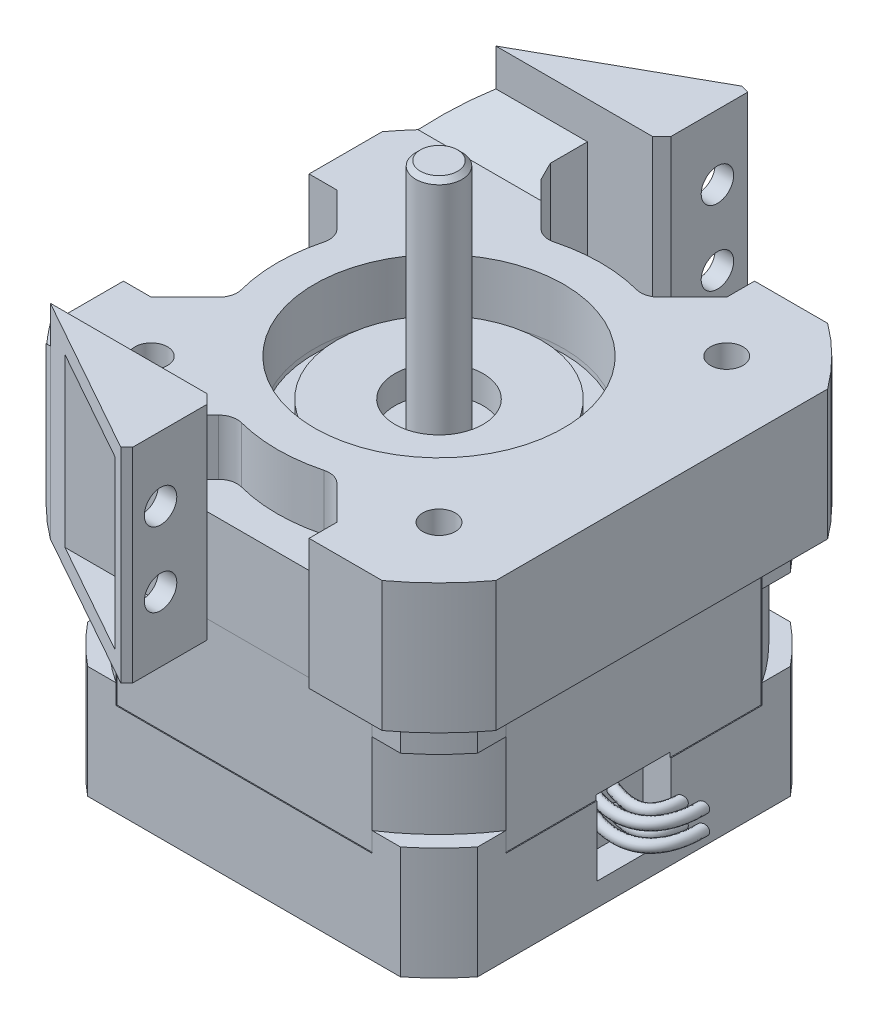
from build123d import *
from OCP.BRepFilletAPI import BRepFilletAPI_MakeChamfer

# Parameters (mm, degrees)
BOSS_EXTRUDE2_DEPTH       = 33
SKETCH3_W                 = 5
SKETCH3_H                 = 8.75
SKETCH4_R                 = 13.425
CUT_EXTRUDE1_DEPTH        = 0.5
SKETCH5_R                 = 11
BOSS_EXTRUDE3_DEPTH       = 2.5
SKETCH6_R                 = 4.75
CUT_EXTRUDE2_DEPTH        = 3
SKETCH7_R                 = 2.5
BOSS_EXTRUDE4_DEPTH       = 25.25
CHAMFER1_SIZE             = 0.5
SKETCH8_R                 = 4.5
CUT_EXTRUDE3_DEPTH        = 3
M3X0_5_TAPPED_HOLE1_D     = 2.5
M3X0_5_TAPPED_HOLE1_DEPTH = 4.5
M3X0_5_TAPPED_HOLE1_TIP   = 0.751075774
SKETCH12_W                = 8
SKETCH12_H                = 8
CUT_EXTRUDE4_DEPTH        = 3
SKETCH13_R                = 0.6
SKETCH15_W                = 27.587361236
SKETCH15_H                = 13
CUT_EXTRUDE5_DEPTH        = 0.1
CIRPATTERN1_COUNT         = 4
SKETCH16_R                = 1.75
SKETCH16_R_2              = 17.425
SKETCH16_R_3              = 13.425
BOSS_EXTRUDE5_DEPTH       = 6
BOSS_EXTRUDE6_DEPTH       = 14
BOSS_EXTRUDE6_2_DEPTH     = 14
BOSS_EXTRUDE6_3_DEPTH     = 14
FILLET1_R                 = 2
BOSS_EXTRUDE7_DEPTH       = 6
BOSS_EXTRUDE7_2_DEPTH     = 6
BOSS_EXTRUDE7_3_DEPTH     = 6
BOSS_EXTRUDE8_DEPTH       = 14
SKETCH20_W                = 8
SKETCH20_H                = 10
CUT_EXTRUDE7_DEPTH        = 34
CHAMFER2_SIZE             = 2
SKETCH19_R                = 1.75
CUT_EXTRUDE10_DEPTH       = 10
BOSS_EXTRUDE9_DEPTH       = 8
CUT_EXTRUDE11_DEPTH       = 8
SKETCH23_R                = 1.75
CUT_EXTRUDE13_DEPTH       = 2
CHAMFER3_SIZE             = 4
CHAMFER4_SIZE             = 1
CHAMFER4_SIZE2            = 0.734776912


with BuildPart() as part:
    # Sketch1 → Boss-Extrude2 (new body)
    with BuildSketch(Plane(origin=(0, 0, 0), x_dir=(1, 0, 0), z_dir=(0, 1, 0))):
        with BuildLine():
            Line((-21, 16.850982909), (-21, -16.850982909))
            ThreePointArc((-21, -16.850982909), (-19.038850083, -19.038850083), (-16.850982909, -21))
            Line((-16.850982909, -21), (16.850982909, -21))
            ThreePointArc((16.850982909, -21), (19.038850083, -19.038850083), (21, -16.850982909))
            Line((21, -16.850982909), (21, 16.850982909))
            ThreePointArc((21, 16.850982909), (19.038850083, 19.038850083), (16.850982909, 21))
            Line((16.850982909, 21), (-16.850982909, 21))
            ThreePointArc((-16.850982909, 21), (-19.038850083, 19.038850083), (-21, 16.850982909))
        make_face()
    extrude(amount=BOSS_EXTRUDE2_DEPTH)

    # Sketch3 → Cut-Revolve1 (revolve, cut)
    with BuildSketch(Plane.XY):
        with Locations((-27.625, 16.5)):
            Rectangle(SKETCH3_W, SKETCH3_H)
    revolve(axis=Axis((0, -2.013056064, 0), (0, 1, 0)), mode=Mode.SUBTRACT)

    # Sketch4 → Cut-Extrude1 (cut)
    with BuildSketch(Plane(origin=(0, 33, 0), x_dir=(1, 0, 0), z_dir=(0, 1, 0))):
        with Locations(Location((0, 0, 0), (0, 0, 270))):
            Circle(SKETCH4_R)
    extrude(amount=-CUT_EXTRUDE1_DEPTH, mode=Mode.SUBTRACT)

    # Sketch5 → Boss-Extrude3 (add)
    with BuildSketch(Plane(origin=(0, 32.5, 0), x_dir=(1, 0, 0), z_dir=(0, 1, 0))):
        with Locations(Location((0, 0, 0), (0, 0, 270))):
            Circle(SKETCH5_R)
    extrude(amount=BOSS_EXTRUDE3_DEPTH)

    # Sketch6 → Cut-Extrude2 (cut)
    with BuildSketch(Plane(origin=(0, 35, 0), x_dir=(1, 0, 0), z_dir=(0, 1, 0))):
        with Locations(Location((0, 0, 0), (0, 0, 270))):
            Circle(SKETCH6_R)
    extrude(amount=-CUT_EXTRUDE2_DEPTH, mode=Mode.SUBTRACT)

    # Sketch7 → Boss-Extrude4 (add)
    with BuildSketch(Plane(origin=(0, 32, 0), x_dir=(1, 0, 0), z_dir=(0, 1, 0))):
        with Locations(Location((0, 0, 0), (0, 0, 270))):
            Circle(SKETCH7_R)
    extrude(amount=BOSS_EXTRUDE4_DEPTH)

    # Chamfer1
    chamfer1_edges = [part.edges().sort_by_distance(p)[0] for p in [
        (0, 57.25, -2.5),
    ]]
    chamfer(chamfer1_edges, length=CHAMFER1_SIZE)

    # Sketch8 → Cut-Extrude3 (cut)
    with BuildSketch(Plane.XZ):
        with Locations(Location((0, 0, 0), (0, 0, 270))):
            Circle(SKETCH8_R)
    extrude(amount=-CUT_EXTRUDE3_DEPTH, mode=Mode.SUBTRACT)

    # M3x0.5 Tapped Hole1
    with Locations(Plane(origin=(0, 33, 0), x_dir=(1, 0, 0), z_dir=(0, 1, 0))):
        with Locations((-15.5, -15.5), (-15.5, 15.5), (15.5, 15.5), (15.5, -15.5)):
            Hole(M3X0_5_TAPPED_HOLE1_D / 2, depth=M3X0_5_TAPPED_HOLE1_DEPTH)
            with Locations((0, 0, -(M3X0_5_TAPPED_HOLE1_DEPTH + M3X0_5_TAPPED_HOLE1_TIP / 2))):  # 118° drill point
                Cone(0, M3X0_5_TAPPED_HOLE1_D / 2, M3X0_5_TAPPED_HOLE1_TIP, mode=Mode.SUBTRACT)

    # Sketch12 → Cut-Extrude4 (cut)
    with BuildSketch(Plane(origin=(21, 0, 0), x_dir=(0, 0, -1), z_dir=(1, 0, 0))):
        with Locations((0, 6.5)):
            Rectangle(SKETCH12_W, SKETCH12_H)
    extrude(amount=-CUT_EXTRUDE4_DEPTH, mode=Mode.SUBTRACT)

    # Sweep2: sweep along a path in Sketch14
    with BuildLine() as sweep2_path:  # in the path sketch's own coordinates; laid on its plane below (add() does not lay a ready-made edge on the line's plane)
        add(Edge.make_bspline(
            [(17.676713236, 0), (23.6460823, -2.366766531), (23.798444163, 3.357568307)],
            knots=[0, 0, 0, 1, 1, 1], degree=2))
    # Sketch13 → Sweep2 (sweep)
    with BuildSketch(Plane(origin=(18, 0, 0), x_dir=(0, 0, -1), z_dir=(1, 0, 0))):
        with Locations((-1.112460133, 7.415030797)):
            Circle(SKETCH13_R)
        with Locations((0.707044587, 7.415030797)):
            Circle(SKETCH13_R)
        with Locations((-1.112460133, 5.332176709)):
            Circle(SKETCH13_R)
        with Locations((0.707044587, 5.332176709)):
            Circle(SKETCH13_R)
    sweep(path=Plane(origin=(0, 0, 0), x_dir=(1, 0, 0), z_dir=(0, 1, 0)) * sweep2_path.line)

    # Sketch15 → Cut-Extrude5 (cut)
    with BuildSketch(Plane(origin=(0, 0, -21), x_dir=(-1, 0, 0), z_dir=(0, 0, -1))):
        with Locations((0, 16.5)):
            Rectangle(SKETCH15_W, SKETCH15_H)
    cut_extrude5 = extrude(amount=-CUT_EXTRUDE5_DEPTH, mode=Mode.SUBTRACT)

    # CirPattern1: Cut-Extrude5 ×4 about axis
    cirpattern1_axis = Axis((0, 0, 0), (0, 1, 0))
    for i in range(1, CIRPATTERN1_COUNT):
        add(cut_extrude5.rotate(cirpattern1_axis, i * 360 / CIRPATTERN1_COUNT), mode=Mode.SUBTRACT)


with BuildPart() as body_2:
    # Sketch16 → Boss-Extrude5 (new body)
    # profile 1 of 4: a face of its own
    with BuildSketch(Plane(origin=(0, 33, 0), x_dir=(1, 0, 0), z_dir=(0, 1, 0))):
        with BuildLine():
            Line((-16.850982909, -21), (-10.000982909, -21))
            Line((-10.000982909, -21), (-5.526402676, -16.525419767))
            ThreePointArc((-5.526402676, -16.525419767), (-12.321884857, -12.320786443), (-16.525912365, -5.524929456))
            Line((-16.525912365, -5.524929456), (-21, -9.999017091))
            Line((-21, -9.999017091), (-21, -16.850982909))
            ThreePointArc((-21, -16.850982909), (-19.038850083, -19.038850083), (-16.850982909, -21))
        make_face()
        with Locations(Location((-15.5, -15.5, 0), (0, 0, 270))):
            Circle(SKETCH16_R, mode=Mode.SUBTRACT)
    # profile 2 of 4: a face of its own
    with BuildSketch(Plane(origin=(0, 33, 0), x_dir=(1, 0, 0), z_dir=(0, 1, 0))):
        Circle(SKETCH16_R_2)
        with Locations(Location((0, 0, 0), (0, 0, 270))):
            Circle(SKETCH16_R_3, mode=Mode.SUBTRACT)
    # profile 3 of 4: a face of its own
    with BuildSketch(Plane(origin=(0, 33, 0), x_dir=(1, 0, 0), z_dir=(0, 1, 0))):
        with BuildLine():
            Line((-21, 10.000982909), (-16.525419767, 5.526402676))
            ThreePointArc((-16.525419767, 5.526402676), (-12.321335662, 12.321335662), (-5.526402676, 16.525419767))
            Line((-5.526402676, 16.525419767), (-10.000982909, 21))
            Line((-10.000982909, 21), (-16.850982909, 21))
            ThreePointArc((-16.850982909, 21), (-19.038850083, 19.038850083), (-21, 16.850982909))
            Line((-21, 16.850982909), (-21, 10.000982909))
        make_face()
        with Locations(Location((-15.5, 15.5, 0), (0, 0, 270))):
            Circle(SKETCH16_R, mode=Mode.SUBTRACT)
    # profile 4 of 4: a face of its own
    with BuildSketch(Plane(origin=(0, 33, 0), x_dir=(1, 0, 0), z_dir=(0, 1, 0))):
        with BuildLine():
            Line((5.524929456, -16.525912365), (9.999017091, -21))
            Line((9.999017091, -21), (16.850982909, -21))
            ThreePointArc((16.850982909, -21), (19.038850083, -19.038850083), (21, -16.850982909))
            Line((21, -16.850982909), (21, 16.850982909))
            ThreePointArc((21, 16.850982909), (19.038850083, 19.038850083), (16.850982909, 21))
            Line((16.850982909, 21), (9.999017091, 21))
            Line((9.999017091, 21), (5.524929456, 16.525912365))
            ThreePointArc((5.524929456, 16.525912365), (14.140412313, 10.182306449), (17.425, 0))
            ThreePointArc((17.425, 0), (14.140412313, -10.182306449), (5.524929456, -16.525912365))
        make_face()
        with Locations(Location((15.5, -15.5, 0), (0, 0, 270))):
            Circle(SKETCH16_R, mode=Mode.SUBTRACT)
        with Locations(Location((15.5, 15.5, 0), (0, 0, 270))):
            Circle(SKETCH16_R, mode=Mode.SUBTRACT)
    extrude(amount=BOSS_EXTRUDE5_DEPTH)

    # Fillet1
    fillet1_edges = [body_2.edges().sort_by_distance(p)[0] for p in [
        (-16.525912365, 36, 5.524929456),
        (-16.525419767, 36, -5.526402676),
        (-5.526402676, 36, -16.525419767),
        (5.524929456, 36, -16.525912365),
        (5.524929456, 36, 16.525912365),
        (-5.526402676, 36, 16.525419767),
    ]]
    fillet(fillet1_edges, radius=FILLET1_R)


with BuildPart() as body_3:
    # Sketch17 → Boss-Extrude6 (new body)
    with BuildSketch(Plane(origin=(0, 39, 0), x_dir=(1, 0, 0), z_dir=(0, 1, 0))):
        with BuildLine():
            Line((-24, 10.000982909), (-21.5, 10.000982909))
            Line((-21.5, 10.000982909), (-21.5, 17.025881034))
            ThreePointArc((-21.5, 17.025881034), (-19.392403474, 19.392403474), (-17.025881034, 21.5))
            Line((-17.025881034, 21.5), (-10.000982909, 21.5))
            Line((-10.000982909, 21.5), (-10.000982909, 24))
            Line((-10.000982909, 24), (-17.874720278, 24))
            ThreePointArc((-17.874720278, 24), (-21.160170427, 21.160170427), (-24, 17.874720278))
            Line((-24, 17.874720278), (-24, 10.000982909))
        make_face()
    extrude(amount=-BOSS_EXTRUDE6_DEPTH)


with BuildPart() as body_4:
    # Sketch17 → Boss-Extrude6 2 (new body)
    with BuildSketch(Plane(origin=(0, 39, 0), x_dir=(1, 0, 0), z_dir=(0, 1, 0))):
        with BuildLine():
            Line((-21.5, -17.025881034), (-21.5, -9.999017091))
            Line((-21.5, -9.999017091), (-24, -9.999017091))
            Line((-24, -9.999017091), (-24, -17.874720278))
            ThreePointArc((-24, -17.874720278), (-21.160170427, -21.160170427), (-17.874720278, -24))
            Line((-17.874720278, -24), (-10.000982909, -24))
            Line((-10.000982909, -24), (-10.000982909, -21.5))
            Line((-10.000982909, -21.5), (-17.025881034, -21.5))
            ThreePointArc((-17.025881034, -21.5), (-19.392403474, -19.392403474), (-21.5, -17.025881034))
        make_face()
    extrude(amount=-BOSS_EXTRUDE6_2_DEPTH)


with BuildPart() as body_5:
    # Sketch17 → Boss-Extrude6 3 (new body)
    with BuildSketch(Plane(origin=(0, 39, 0), x_dir=(1, 0, 0), z_dir=(0, 1, 0))):
        with BuildLine():
            Line((9.999017091, 24), (9.999017091, 21.5))
            Line((9.999017091, 21.5), (17.025881034, 21.5))
            ThreePointArc((17.025881034, 21.5), (19.392403474, 19.392403474), (21.5, 17.025881034))
            Line((21.5, 17.025881034), (21.5, -17.025881034))
            ThreePointArc((21.5, -17.025881034), (19.392403474, -19.392403474), (17.025881034, -21.5))
            Line((17.025881034, -21.5), (9.999017091, -21.5))
            Line((9.999017091, -21.5), (9.999017091, -24))
            Line((9.999017091, -24), (17.874720278, -24))
            ThreePointArc((17.874720278, -24), (21.160170427, -21.160170427), (24, -17.874720278))
            Line((24, -17.874720278), (24, 17.874720278))
            ThreePointArc((24, 17.874720278), (21.160170427, 21.160170427), (17.874720278, 24))
            Line((17.874720278, 24), (9.999017091, 24))
        make_face()
    extrude(amount=-BOSS_EXTRUDE6_3_DEPTH)


with BuildPart() as body_6:
    # Sketch17<4> → Boss-Extrude7 (new body)
    with BuildSketch(Plane(origin=(0, 39, 0), x_dir=(1, 0, 0), z_dir=(0, 1, 0))):
        with BuildLine():
            Line((-21, -9.999017091), (-21.5, -9.999017091))
            Line((-21.5, -9.999017091), (-21.5, -17.025881034))
            ThreePointArc((-21.5, -17.025881034), (-19.392403474, -19.392403474), (-17.025881034, -21.5))
            Line((-17.025881034, -21.5), (-10.000982909, -21.5))
            Line((-10.000982909, -21.5), (-10.000982909, -21))
            Line((-10.000982909, -21), (-16.850982909, -21))
            ThreePointArc((-16.850982909, -21), (-19.038850083, -19.038850083), (-21, -16.850982909))
            Line((-21, -16.850982909), (-21, -9.999017091))
        make_face()
    extrude(amount=-BOSS_EXTRUDE7_DEPTH)


with BuildPart() as body_7:
    # Sketch17<4> → Boss-Extrude7 2 (new body)
    with BuildSketch(Plane(origin=(0, 39, 0), x_dir=(1, 0, 0), z_dir=(0, 1, 0))):
        with BuildLine():
            Line((-21.5, 10.000982909), (-21, 10.000982909))
            Line((-21, 10.000982909), (-21, 16.850982909))
            ThreePointArc((-21, 16.850982909), (-19.038850083, 19.038850083), (-16.850982909, 21))
            Line((-16.850982909, 21), (-10.000982909, 21))
            Line((-10.000982909, 21), (-10.000982909, 21.5))
            Line((-10.000982909, 21.5), (-17.025881034, 21.5))
            ThreePointArc((-17.025881034, 21.5), (-19.392403474, 19.392403474), (-21.5, 17.025881034))
            Line((-21.5, 17.025881034), (-21.5, 10.000982909))
        make_face()
    extrude(amount=-BOSS_EXTRUDE7_2_DEPTH)


with BuildPart() as body_8:
    # Sketch17<4> → Boss-Extrude7 3 (new body)
    with BuildSketch(Plane(origin=(0, 39, 0), x_dir=(1, 0, 0), z_dir=(0, 1, 0))):
        with BuildLine():
            Line((17.025881034, 21.5), (9.999017091, 21.5))
            Line((9.999017091, 21.5), (9.999017091, 21))
            Line((9.999017091, 21), (16.850982909, 21))
            ThreePointArc((16.850982909, 21), (19.038850083, 19.038850083), (21, 16.850982909))
            Line((21, 16.850982909), (21, -16.850982909))
            ThreePointArc((21, -16.850982909), (19.038850083, -19.038850083), (16.850982909, -21))
            Line((16.850982909, -21), (9.999017091, -21))
            Line((9.999017091, -21), (9.999017091, -21.5))
            Line((9.999017091, -21.5), (17.025881034, -21.5))
            ThreePointArc((17.025881034, -21.5), (19.392403474, -19.392403474), (21.5, -17.025881034))
            Line((21.5, -17.025881034), (21.5, 17.025881034))
            ThreePointArc((21.5, 17.025881034), (19.392403474, 19.392403474), (17.025881034, 21.5))
        make_face()
    extrude(amount=-BOSS_EXTRUDE7_3_DEPTH)


with BuildPart() as body_5_1:
    add(body_5.part)

    # Combine2: union body 8, body 7, body 2, body 3, body 4, body 6
    add(body_8.part)
    add(body_7.part)
    add(body_2.part)
    add(body_3.part)
    add(body_4.part)
    add(body_6.part)

    # Sketch18 → Boss-Extrude8 (add)
    with BuildSketch(Plane(origin=(0, 39, 0), x_dir=(1, 0, 0), z_dir=(0, 1, 0))):
        Polygon((-10.000982909, 24), (-0.000982909, 24), (-0.000982909, 34), (-17.874720278, 24), align=None)
        Polygon((-17.874720278, -24), (-0.000982909, -24), (-0.000982909, -34), align=None)
    extrude(amount=-BOSS_EXTRUDE8_DEPTH)

    # Sketch20 → Cut-Extrude7 (cut)
    with BuildSketch(Plane(origin=(-2.000982909, 0, 0), x_dir=(0, 0, -1), z_dir=(1, 0, 0))):
        with Locations((30, 32)):
            Rectangle(SKETCH20_W, SKETCH20_H)
        with Locations((-30, 32)):
            Rectangle(SKETCH20_W, SKETCH20_H)
    extrude(amount=-CUT_EXTRUDE7_DEPTH, mode=Mode.SUBTRACT)

    # Chamfer2
    chamfer2_edges = [body_5_1.edges().sort_by_distance(p)[0] for p in [
        (-10.000982909, 32, -24),
        (-10.000982909, 32, 24),
    ]]
    chamfer(chamfer2_edges, length=CHAMFER2_SIZE)

    # Sketch19 → Cut-Extrude10 (cut)
    with BuildSketch(Plane(origin=(-0.000982909, 0, 0), x_dir=(0, 0, -1), z_dir=(1, 0, 0))):
        with Locations((30, 32)):
            Circle(SKETCH19_R)
        with Locations((-30, 32)):
            Circle(SKETCH19_R)
    extrude(amount=-CUT_EXTRUDE10_DEPTH, mode=Mode.SUBTRACT)

    # Sketch21 → Boss-Extrude9 (add)
    with BuildSketch(Plane(origin=(0, 39, 0), x_dir=(1, 0, 0), z_dir=(0, 1, 0))):
        Polygon((-17.874720278, -24), (-8.000982909, -24), (-0.000982909, -24), (-0.000982909, -34), align=None)
        Polygon((-8.000982909, 24), (-17.874720278, 24), (-0.000982909, 34), (-0.000982909, 24), align=None)
    extrude(amount=BOSS_EXTRUDE9_DEPTH)

    # Sketch22 → Cut-Extrude11 (cut)
    with BuildSketch(Plane.XZ.offset(-37)):
        Polygon((-14.299972804, -26), (-2.000982909, -32.881039841), (-2.000982909, -26), align=None)
        Polygon((-14.299972804, 26), (-2.000982909, 26), (-2.000982909, 32.881039841), align=None)
    extrude(amount=-CUT_EXTRUDE11_DEPTH, mode=Mode.SUBTRACT)

    # Sketch23 → Cut-Extrude13 (cut)
    with BuildSketch(Plane.ZY.offset(2.000982909)):
        with Locations((30, 40)):
            Circle(SKETCH23_R)
        with Locations((-30, 40)):
            Circle(SKETCH23_R)
    extrude(amount=-CUT_EXTRUDE13_DEPTH, mode=Mode.SUBTRACT)

    # Chamfer3
    # the kernel refuses this chamfer: 4 mm, written as the material it adds along each edge
    with BuildSketch(Plane(origin=(-28.161452229, 39, -24), x_dir=(0, -0.027495876610585623, 0.9996219169112968), z_dir=(1, 0, 0))) as chamfer3_piece_1_section:
        Polygon((CHAMFER3_SIZE * 0.999621916911, -CHAMFER3_SIZE * 0.0274958766106), (-CHAMFER3_SIZE * 0.0274958766106, -CHAMFER3_SIZE * 0.999621916911), (0, 0), align=None)
    chamfer3_piece_1 = extrude(amount=30.447201272, mode=Mode.PRIVATE)
    chamfer3_piece_1 = split(chamfer3_piece_1, bisect_by=Plane(origin=(-13.573491828, 40.190140446, -24.572508919), z_dir=(-0.7071067811865431, 0, 0.7071067811865519)), keep=Keep.TOP, mode=Mode.PRIVATE)
    chamfer3_piece_1 = chamfer3_piece_1 & Plane(origin=(0, 40.190140446, 0), x_dir=(-0.5973173025073211, 0, -0.8020050125313292), z_dir=(0, 1, 0)) * Cylinder(29.925, 77, mode=Mode.PRIVATE)
    chamfer3_piece_1 = split(chamfer3_piece_1, bisect_by=Plane(origin=(-12.632482531, 40.190140446, -19.368500378), z_dir=(-0.7071067811865476, 0, -0.7071067811865476)), keep=Keep.TOP, mode=Mode.PRIVATE)
    chamfer3_piece_1 = split(chamfer3_piece_1, bisect_by=Plane(origin=(-16.886535328, 40.190140446, -24.552869794), z_dir=(0.4882579176655908, 0, 0.8726993788452363)), keep=Keep.TOP, mode=Mode.PRIVATE)
    add(chamfer3_piece_1)
    with BuildSketch(Plane(origin=(-28.161452229, 39, -24), x_dir=(0, -0.027495876610585623, 0.9996219169112968), z_dir=(1, 0, 0))) as chamfer3_piece_2_section:
        Polygon((CHAMFER3_SIZE * 0.999621916911, -CHAMFER3_SIZE * 0.0274958766106), (-CHAMFER3_SIZE * 0.0274958766106, -CHAMFER3_SIZE * 0.999621916911), (0, 0), align=None)
    chamfer3_piece_2 = extrude(amount=30.447201272, mode=Mode.PRIVATE)
    chamfer3_piece_2 = split(chamfer3_piece_2, bisect_by=Plane(origin=(-10.000982909, 40.640462422, -23.281768018), z_dir=(-1, 0, 0)), keep=Keep.TOP, mode=Mode.PRIVATE)
    chamfer3_piece_2 = split(chamfer3_piece_2, bisect_by=Plane(origin=(-11.713613426, 40.640462422, -22.712630517), z_dir=(0.7071067811865431, 0, -0.7071067811865519)), keep=Keep.TOP, mode=Mode.PRIVATE)
    chamfer3_piece_2 = split(chamfer3_piece_2, bisect_by=Plane(origin=(-9.931845408, 40.640462422, -22.069137501), z_dir=(-0.7071067811865476, 0, -0.7071067811865476)), keep=Keep.TOP, mode=Mode.PRIVATE)
    add(chamfer3_piece_2)
    with BuildSketch(Plane(origin=(-28.161452229, 39, -24), x_dir=(0, -0.027495876610585623, 0.9996219169112968), z_dir=(1, 0, 0))) as chamfer3_piece_3_section:
        Polygon((CHAMFER3_SIZE * 0.999621916911, -CHAMFER3_SIZE * 0.0274958766106), (-CHAMFER3_SIZE * 0.0274958766106, -CHAMFER3_SIZE * 0.999621916911), (0, 0), align=None)
    chamfer3_piece_3 = extrude(amount=30.447201272, mode=Mode.PRIVATE)
    chamfer3_piece_3 = split(chamfer3_piece_3, bisect_by=Plane(origin=(-10.000982909, 39.287111889, -20.710319655), z_dir=(-1, 0, 0)), keep=Keep.TOP, mode=Mode.PRIVATE)
    chamfer3_piece_3 = split(chamfer3_piece_3, bisect_by=Plane(origin=(-10.189906984, 39.287111889, -21.188924075), z_dir=(-0.7071067811865431, 0, 0.7071067811865519)), keep=Keep.TOP, mode=Mode.PRIVATE)
    chamfer3_piece_3 = split(chamfer3_piece_3, bisect_by=Plane(origin=(-10.979587329, 39.287111889, -21.02139558), z_dir=(0.7071067811865476, 0, 0.7071067811865476)), keep=Keep.TOP, mode=Mode.PRIVATE)
    add(chamfer3_piece_3)
    with BuildSketch(Plane(origin=(-28.161452229, 39, -24), x_dir=(0, -0.027495876610585623, 0.9996219169112968), z_dir=(1, 0, 0))) as chamfer3_piece_4_section:
        Polygon((CHAMFER3_SIZE * 0.999621916911, -CHAMFER3_SIZE * 0.0274958766106), (-CHAMFER3_SIZE * 0.0274958766106, -CHAMFER3_SIZE * 0.999621916911), (0, 0), align=None)
    chamfer3_piece_4 = extrude(amount=30.447201272, mode=Mode.PRIVATE)
    chamfer3_piece_4 = split(chamfer3_piece_4, bisect_by=Plane(origin=(-10.000982909, 40.745550049, -23.470489523), z_dir=(1, 0, 0)), keep=Keep.TOP, mode=Mode.PRIVATE)
    chamfer3_piece_4 = split(chamfer3_piece_4, bisect_by=Plane(origin=(-8.898115767, 40.745550049, -23.102867142), z_dir=(-0.7071067811865476, 0, -0.7071067811865476)), keep=Keep.TOP, mode=Mode.PRIVATE)
    add(chamfer3_piece_4)
    with BuildSketch(Plane(origin=(-28.161452229, 39, -24), x_dir=(0, -0.027495876610585623, 0.9996219169112968), z_dir=(1, 0, 0))) as chamfer3_piece_5_section:
        Polygon((CHAMFER3_SIZE * 0.999621916911, -CHAMFER3_SIZE * 0.0274958766106), (-CHAMFER3_SIZE * 0.0274958766106, -CHAMFER3_SIZE * 0.999621916911), (0, 0), align=None)
    chamfer3_piece_5 = extrude(amount=30.447201272, mode=Mode.PRIVATE)
    chamfer3_piece_5 = split(chamfer3_piece_5, bisect_by=Plane(origin=(-10.000982909, 39.715355769, -21.525090249), z_dir=(-1, 0, 0)), keep=Keep.TOP, mode=Mode.PRIVATE)
    chamfer3_piece_5 = split(chamfer3_piece_5, bisect_by=Plane(origin=(-10.346849718, 39.715355769, -21.345866809), z_dir=(0.7071067811865431, 0, -0.7071067811865519)), keep=Keep.TOP, mode=Mode.PRIVATE)
    chamfer3_piece_5 = split(chamfer3_piece_5, bisect_by=Plane(origin=(-10.321759469, 39.715355769, -21.67922344), z_dir=(0.7071067811865476, 0, 0.7071067811865476)), keep=Keep.TOP, mode=Mode.PRIVATE)
    add(chamfer3_piece_5)
    with BuildSketch(Plane(origin=(-28.161452229, 39, -24), x_dir=(0, -0.027495876610585623, 0.9996219169112968), z_dir=(1, 0, 0))) as chamfer3_piece_6_section:
        Polygon((CHAMFER3_SIZE * 0.999621916911, -CHAMFER3_SIZE * 0.0274958766106), (-CHAMFER3_SIZE * 0.0274958766106, -CHAMFER3_SIZE * 0.999621916911), (0, 0), align=None)
    chamfer3_piece_6 = extrude(amount=30.447201272, mode=Mode.PRIVATE)
    chamfer3_piece_6 = split(chamfer3_piece_6, bisect_by=Plane(origin=(-10.000982909, 39.127257252, -20.409088831), z_dir=(1, 0, 0)), keep=Keep.TOP, mode=Mode.PRIVATE)
    chamfer3_piece_6 = split(chamfer3_piece_6, bisect_by=Plane(origin=(-9.557799532, 39.127257252, -20.556816623), z_dir=(-0.7071067811865431, 0, 0.7071067811865519)), keep=Keep.TOP, mode=Mode.PRIVATE)
    add(chamfer3_piece_6)
    with BuildSketch(Plane(origin=(2.285749043, 39, 24), x_dir=(0, -0.027495876610585623, -0.9996219169112968), z_dir=(-1, 0, 0))) as chamfer3_piece_7_section:
        Polygon((CHAMFER3_SIZE * 0.999621916911, -CHAMFER3_SIZE * 0.0274958766106), (-CHAMFER3_SIZE * 0.0274958766106, -CHAMFER3_SIZE * 0.999621916911), (0, 0), align=None)
    chamfer3_piece_7 = extrude(amount=30.447201272, mode=Mode.PRIVATE)
    chamfer3_piece_7 = split(chamfer3_piece_7, bisect_by=Plane(origin=(-10.000982909, 40.745550049, 23.470489523), z_dir=(1, 0, 0)), keep=Keep.TOP, mode=Mode.PRIVATE)
    chamfer3_piece_7 = split(chamfer3_piece_7, bisect_by=Plane(origin=(-8.898115767, 40.745550049, 23.102867142), z_dir=(-0.7071067811865476, 0, 0.7071067811865476)), keep=Keep.TOP, mode=Mode.PRIVATE)
    add(chamfer3_piece_7)
    with BuildSketch(Plane(origin=(2.285749043, 39, 24), x_dir=(0, -0.027495876610585623, -0.9996219169112968), z_dir=(-1, 0, 0))) as chamfer3_piece_8_section:
        Polygon((CHAMFER3_SIZE * 0.999621916911, -CHAMFER3_SIZE * 0.0274958766106), (-CHAMFER3_SIZE * 0.0274958766106, -CHAMFER3_SIZE * 0.999621916911), (0, 0), align=None)
    chamfer3_piece_8 = extrude(amount=30.447201272, mode=Mode.PRIVATE)
    chamfer3_piece_8 = split(chamfer3_piece_8, bisect_by=Plane(origin=(-10.346849718, 39.715355769, 21.345866809), z_dir=(0.7071067811865487, 0, 0.7071067811865465)), keep=Keep.TOP, mode=Mode.PRIVATE)
    chamfer3_piece_8 = split(chamfer3_piece_8, bisect_by=Plane(origin=(-10.000982909, 39.715355769, 21.525090249), z_dir=(-1, 0, 0)), keep=Keep.TOP, mode=Mode.PRIVATE)
    chamfer3_piece_8 = split(chamfer3_piece_8, bisect_by=Plane(origin=(-10.321759469, 39.715355769, 21.67922344), z_dir=(0.7071067811865476, 0, -0.7071067811865476)), keep=Keep.TOP, mode=Mode.PRIVATE)
    add(chamfer3_piece_8)
    with BuildSketch(Plane(origin=(2.285749043, 39, 24), x_dir=(0, -0.027495876610585623, -0.9996219169112968), z_dir=(-1, 0, 0))) as chamfer3_piece_9_section:
        Polygon((CHAMFER3_SIZE * 0.999621916911, -CHAMFER3_SIZE * 0.0274958766106), (-CHAMFER3_SIZE * 0.0274958766106, -CHAMFER3_SIZE * 0.999621916911), (0, 0), align=None)
    chamfer3_piece_9 = extrude(amount=30.447201272, mode=Mode.PRIVATE)
    chamfer3_piece_9 = split(chamfer3_piece_9, bisect_by=Plane(origin=(-9.557799532, 39.127257252, 20.556816623), z_dir=(-0.7071067811865487, 0, -0.7071067811865465)), keep=Keep.TOP, mode=Mode.PRIVATE)
    chamfer3_piece_9 = split(chamfer3_piece_9, bisect_by=Plane(origin=(-10.000982909, 39.127257252, 20.409088831), z_dir=(1, 0, 0)), keep=Keep.TOP, mode=Mode.PRIVATE)
    add(chamfer3_piece_9)
    with BuildSketch(Plane(origin=(2.285749043, 39, 24), x_dir=(0, -0.027495876610585623, -0.9996219169112968), z_dir=(-1, 0, 0))) as chamfer3_piece_10_section:
        Polygon((CHAMFER3_SIZE * 0.999621916911, -CHAMFER3_SIZE * 0.0274958766106), (-CHAMFER3_SIZE * 0.0274958766106, -CHAMFER3_SIZE * 0.999621916911), (0, 0), align=None)
    chamfer3_piece_10 = extrude(amount=30.447201272, mode=Mode.PRIVATE)
    chamfer3_piece_10 = split(chamfer3_piece_10, bisect_by=Plane(origin=(-11.713613426, 40.640462422, 22.712630517), z_dir=(0.7071067811865487, 0, 0.7071067811865465)), keep=Keep.TOP, mode=Mode.PRIVATE)
    chamfer3_piece_10 = split(chamfer3_piece_10, bisect_by=Plane(origin=(-10.000982909, 40.640462422, 23.281768018), z_dir=(-1, 0, 0)), keep=Keep.TOP, mode=Mode.PRIVATE)
    chamfer3_piece_10 = split(chamfer3_piece_10, bisect_by=Plane(origin=(-9.931845408, 40.640462422, 22.069137501), z_dir=(-0.7071067811865476, 0, 0.7071067811865476)), keep=Keep.TOP, mode=Mode.PRIVATE)
    add(chamfer3_piece_10)
    with BuildSketch(Plane(origin=(2.285749043, 39, 24), x_dir=(0, -0.027495876610585623, -0.9996219169112968), z_dir=(-1, 0, 0))) as chamfer3_piece_11_section:
        Polygon((CHAMFER3_SIZE * 0.999621916911, -CHAMFER3_SIZE * 0.0274958766106), (-CHAMFER3_SIZE * 0.0274958766106, -CHAMFER3_SIZE * 0.999621916911), (0, 0), align=None)
    chamfer3_piece_11 = extrude(amount=30.447201272, mode=Mode.PRIVATE)
    chamfer3_piece_11 = split(chamfer3_piece_11, bisect_by=Plane(origin=(-10.189906984, 39.287111889, 21.188924075), z_dir=(-0.7071067811865487, 0, -0.7071067811865465)), keep=Keep.TOP, mode=Mode.PRIVATE)
    chamfer3_piece_11 = split(chamfer3_piece_11, bisect_by=Plane(origin=(-10.000982909, 39.287111889, 20.710319655), z_dir=(-1, 0, 0)), keep=Keep.TOP, mode=Mode.PRIVATE)
    chamfer3_piece_11 = split(chamfer3_piece_11, bisect_by=Plane(origin=(-10.979587329, 39.287111889, 21.02139558), z_dir=(0.7071067811865476, 0, -0.7071067811865476)), keep=Keep.TOP, mode=Mode.PRIVATE)
    add(chamfer3_piece_11)
    with BuildSketch(Plane(origin=(2.285749043, 39, 24), x_dir=(0, -0.027495876610585623, -0.9996219169112968), z_dir=(-1, 0, 0))) as chamfer3_piece_12_section:
        Polygon((CHAMFER3_SIZE * 0.999621916911, -CHAMFER3_SIZE * 0.0274958766106), (-CHAMFER3_SIZE * 0.0274958766106, -CHAMFER3_SIZE * 0.999621916911), (0, 0), align=None)
    chamfer3_piece_12 = extrude(amount=30.447201272, mode=Mode.PRIVATE)
    chamfer3_piece_12 = split(chamfer3_piece_12, bisect_by=Plane(origin=(-13.573491819, 40.190140448, 24.57250891), z_dir=(-0.7071067811865487, 0, -0.7071067811865465)), keep=Keep.TOP, mode=Mode.PRIVATE)
    chamfer3_piece_12 = split(chamfer3_piece_12, bisect_by=Plane(origin=(-12.632482526, 40.190140448, 19.368500383), z_dir=(-0.7071067811865476, 0, 0.7071067811865476)), keep=Keep.TOP, mode=Mode.PRIVATE)
    chamfer3_piece_12 = chamfer3_piece_12 & Plane(origin=(0, 40.190140448, 0), x_dir=(-0.802005012531325, 0, 0.5973173025073268), z_dir=(0, 1, 0)) * Cylinder(29.925, 77, mode=Mode.PRIVATE)
    chamfer3_piece_12 = split(chamfer3_piece_12, bisect_by=Plane(origin=(-16.886535319, 40.190140448, 24.552869799), z_dir=(0.4882579176655908, 0, -0.8726993788452363)), keep=Keep.TOP, mode=Mode.PRIVATE)
    add(chamfer3_piece_12)

    # Chamfer4: one chamfer whose edges measure the first distance from different faces: ONE call of the kernel's chamfer builder (chamfer() names one face for all edges)
    chamfer4_edges_1 = [body_5_1.edges().sort_by_distance(p)[0] for p in [
        (-0.000982909, 36, -34),
    ]]
    chamfer4_side_1 = [body_5_1.faces().sort_by_distance(p)[0] for p in [
        (-8.937851593, 25.300577858, -29),
    ]]
    chamfer4_edges_2 = [body_5_1.edges().sort_by_distance(p)[0] for p in [
        (-0.000982909, 36, -24),
        (-0.000982909, 36, 24),
    ]]
    chamfer4_edges_3 = [body_5_1.edges().sort_by_distance(p)[0] for p in [
        (-0.000982909, 36, 34),
    ]]
    chamfer4_side_3 = [body_5_1.faces().sort_by_distance(p)[0] for p in [
        (-0.000982909, 36, 28.904151867),
    ]]
    chamfer4 = BRepFilletAPI_MakeChamfer(body_5_1.part.solid().wrapped)
    for e in chamfer4_edges_1:
        chamfer4.Add(CHAMFER4_SIZE, CHAMFER4_SIZE2, e.wrapped, chamfer4_side_1[0].wrapped)  # the first distance lies on this face
    for e in chamfer4_edges_2:
        chamfer4.Add(CHAMFER4_SIZE, e.wrapped)
    for e in chamfer4_edges_3:
        chamfer4.Add(CHAMFER4_SIZE, CHAMFER4_SIZE2, e.wrapped, chamfer4_side_3[0].wrapped)  # the first distance lies on this face
    add(Compound.cast(chamfer4.Shape()), mode=Mode.REPLACE)


solid = Compound([part.part, body_5_1.part])
